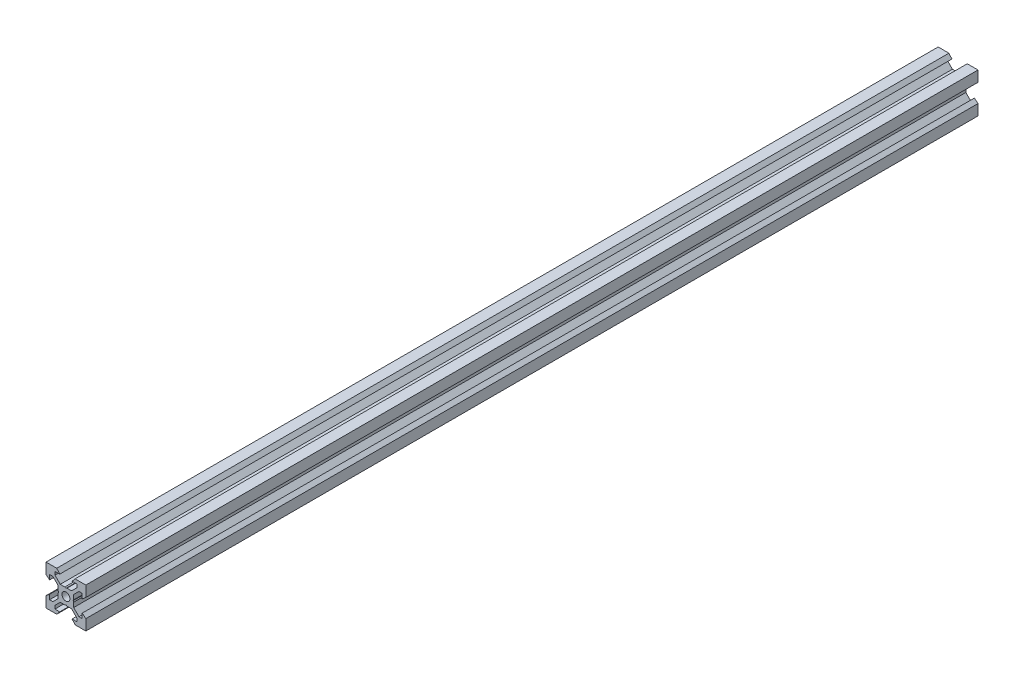
from build123d import *

# Parameters (mm, degrees)
SKETCH1_R           = 2
BOSS_EXTRUDE1_DEPTH = 224


with BuildPart() as part:
    # Sketch1 → Boss-Extrude1 (new, symmetric)
    with BuildSketch(Plane.XY):
        Polygon((10, 4.610379336), (10, 10), (4.610379336, 10), (3.1, 8.2), (5.5, 8.2), (5.5, 6.560660172), (2.839339828, 3.9), (0.519615242, 3.9), (0, 3.6), (-0.519615242, 3.9), (-2.839339828, 3.9), (-5.5, 6.560660172), (-5.5, 8.2), (-3.1, 8.2), (-4.610379336, 10), (-10, 10), (-10, 4.610379336), (-8.2, 3.1), (-8.2, 5.5), (-6.560660172, 5.5), (-3.9, 2.839339828), (-3.9, 0.519615242), (-3.6, 0), (-3.9, -0.519615242), (-3.9, -2.839339828), (-6.560660172, -5.5), (-8.2, -5.5), (-8.2, -3.1), (-10, -4.610379336), (-10, -10), (-4.610379336, -10), (-3.1, -8.2), (-5.5, -8.2), (-5.5, -6.560660172), (-2.839339828, -3.9), (-0.519615242, -3.9), (0, -3.6), (0.519615242, -3.9), (2.839339828, -3.9), (5.5, -6.560660172), (5.5, -8.2), (3.1, -8.2), (4.610379336, -10), (10, -10), (10, -4.610379336), (8.2, -3.1), (8.2, -5.5), (6.560660172, -5.5), (3.9, -2.839339828), (3.9, -0.519615242), (3.6, 0), (3.9, 0.519615242), (3.9, 2.839339828), (6.560660172, 5.5), (8.2, 5.5), (8.2, 3.1), align=None)
        Circle(SKETCH1_R, mode=Mode.SUBTRACT)
    extrude(amount=BOSS_EXTRUDE1_DEPTH, both=True)


solid = part.part
